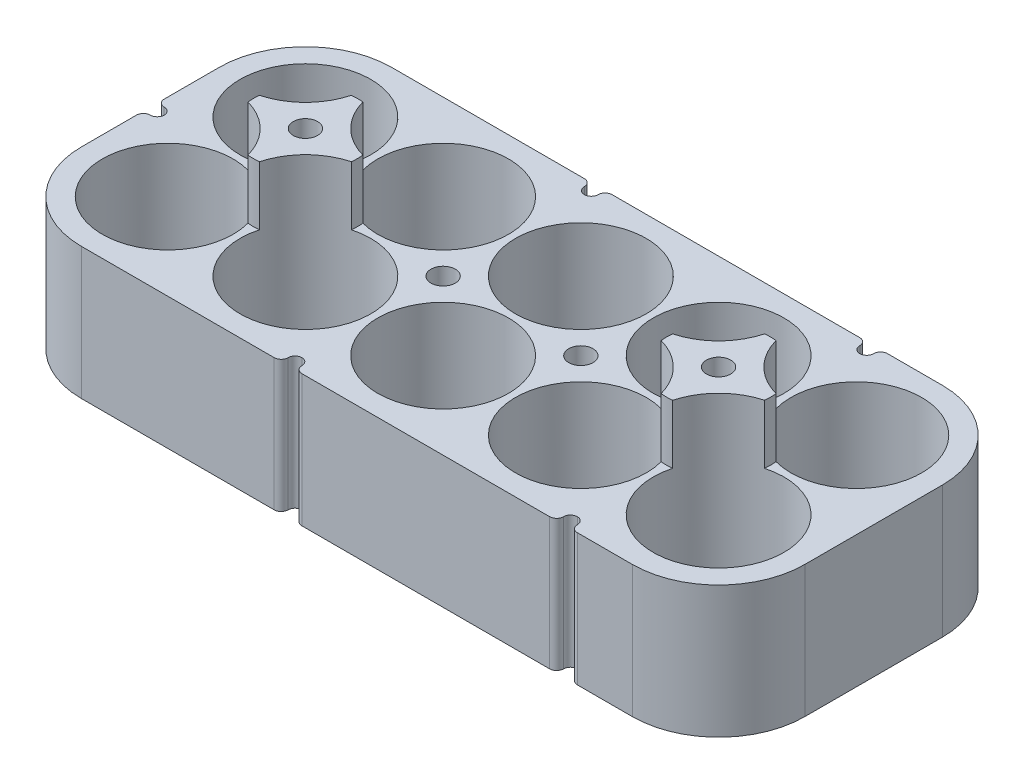
from build123d import *

# Parameters (mm, degrees)
SKETCH2_R               = 9.425
BOSS_EXTRUDE1_DEPTH     = 2.5
CUT_EXTRUDE3_DEPTH      = 57.769605644
CUT_EXTRUDE3_DEPTH_BACK = 57.769605644
SKETCH7_R               = 3
SKETCH7_R_2             = 1.75
SKETCH9_R               = 9.425
SKETCH9_R_2             = 3
BOSS_EXTRUDE2_DEPTH     = 3
SKETCH11_R              = 9.425
SKETCH11_R_2            = 3
SKETCH11_R_3            = 1.75
BOSS_EXTRUDE3_DEPTH     = 6
SKETCH12_R              = 9.425
SKETCH12_R_2            = 1.75
BOSS_EXTRUDE4_DEPTH     = 16
CUT_EXTRUDE4_DEPTH      = 3
SKETCH14_W              = 2
SKETCH14_H              = 2
CUT_EXTRUDE5_DEPTH      = 64.030057314
FILLET1_R               = 1
SKETCH15_W              = 104.25
SKETCH15_H              = 44.7
SKETCH15_R              = 7.5
CUT_EXTRUDE6_DEPTH      = 60.812524817
SKETCH16_R              = 3
BOSS_EXTRUDE5_DEPTH     = 0.3


with BuildPart() as part:
    # Sketch2 → Boss-Extrude1 (new body)
    with BuildSketch(Plane(origin=(0, 0, 0), x_dir=(1, 0, 0), z_dir=(0, 1, 0))):
        with BuildLine():
            Line((-39.7, -22.35), (39.7, -22.35))
            ThreePointArc((39.7, -22.35), (48.485801756, -18.710801756), (52.125, -9.925))
            Line((52.125, -9.925), (52.125, 9.925))
            ThreePointArc((52.125, 9.925), (48.485801756, 18.710801756), (39.7, 22.35))
            Line((39.7, 22.35), (-39.7, 22.35))
            ThreePointArc((-39.7, 22.35), (-48.485801756, 18.710801756), (-52.125, 9.925))
            Line((-52.125, 9.925), (-52.125, -9.925))
            ThreePointArc((-52.125, -9.925), (-48.485801756, -18.710801756), (-39.7, -22.35))
        make_face()
        with Locations(Location((-19.85, 9.925, 0), (0, 0, 270))):
            Circle(SKETCH2_R, mode=Mode.SUBTRACT)
        with Locations(Location((-39.7, -9.925, 0), (0, 0, 270))):
            Circle(SKETCH2_R, mode=Mode.SUBTRACT)
        with Locations(Location((-39.7, 9.925, 0), (0, 0, 270))):
            Circle(SKETCH2_R, mode=Mode.SUBTRACT)
        with Locations(Location((-19.85, -9.925, 0), (0, 0, 270))):
            Circle(SKETCH2_R, mode=Mode.SUBTRACT)
        with Locations(Location((19.85, -9.925, 0), (0, 0, 270))):
            Circle(SKETCH2_R, mode=Mode.SUBTRACT)
        with Locations(Location((39.7, 9.925, 0), (0, 0, 270))):
            Circle(SKETCH2_R, mode=Mode.SUBTRACT)
        with Locations(Location((39.7, -9.925, 0), (0, 0, 270))):
            Circle(SKETCH2_R, mode=Mode.SUBTRACT)
        with Locations(Location((19.85, 9.925, 0), (0, 0, 270))):
            Circle(SKETCH2_R, mode=Mode.SUBTRACT)
        with Locations(Location((0, -9.925, 0), (0, 0, 270))):
            Circle(SKETCH2_R, mode=Mode.SUBTRACT)
        with Locations(Location((0, 9.925, 0), (0, 0, 270))):
            Circle(SKETCH2_R, mode=Mode.SUBTRACT)
    extrude(amount=BOSS_EXTRUDE1_DEPTH)

    # Sketch7 → Cut-Extrude3 (cut, two sides: drawn at the far end of the back side and taken through both)
    with BuildSketch(Plane(origin=(0, 0, 0), x_dir=(1, 0, 0), z_dir=(0, 1, 0)).offset(-CUT_EXTRUDE3_DEPTH_BACK)):
        with Locations(Location((-29.775, 0, 0), (0, 0, 270))):
            Circle(SKETCH7_R)
        with Locations(Location((-9.925, 0, 0), (0, 0, 270))):
            Circle(SKETCH7_R_2)
        with Locations(Location((9.925, 0, 0), (0, 0, 270))):
            Circle(SKETCH7_R_2)
        with Locations(Location((29.775, 0, 0), (0, 0, 270))):
            Circle(SKETCH7_R)
    extrude(amount=CUT_EXTRUDE3_DEPTH + CUT_EXTRUDE3_DEPTH_BACK, mode=Mode.SUBTRACT)

    # Sketch9 → Boss-Extrude2 (add)
    with BuildSketch(Plane(origin=(0, 2.5, 0), x_dir=(1, 0, 0), z_dir=(0, 1, 0))):
        with BuildLine():
            Line((39.7, -22.35), (-39.7, -22.35))
            ThreePointArc((-39.7, -22.35), (-48.485801756, -18.710801756), (-52.125, -9.925))
            Line((-52.125, -9.925), (-52.125, 9.925))
            ThreePointArc((-52.125, 9.925), (-48.485801756, 18.710801756), (-39.7, 22.35))
            Line((-39.7, 22.35), (39.7, 22.35))
            ThreePointArc((39.7, 22.35), (48.485801756, 18.710801756), (52.125, 9.925))
            Line((52.125, 9.925), (52.125, -9.925))
            ThreePointArc((52.125, -9.925), (48.485801756, -18.710801756), (39.7, -22.35))
        make_face()
        with Locations(Location((39.7, -9.925, 0), (0, 0, 270))):
            Circle(SKETCH9_R, mode=Mode.SUBTRACT)
        with Locations(Location((19.85, -9.925, 0), (0, 0, 270))):
            Circle(SKETCH9_R, mode=Mode.SUBTRACT)
        with Locations(Location((0, -9.925, 0), (0, 0, 270))):
            Circle(SKETCH9_R, mode=Mode.SUBTRACT)
        with Locations(Location((-19.85, -9.925, 0), (0, 0, 270))):
            Circle(SKETCH9_R, mode=Mode.SUBTRACT)
        with Locations(Location((-39.7, -9.925, 0), (0, 0, 270))):
            Circle(SKETCH9_R, mode=Mode.SUBTRACT)
        with Locations(Location((-39.7, 9.925, 0), (0, 0, 270))):
            Circle(SKETCH9_R, mode=Mode.SUBTRACT)
        with Locations(Location((-19.85, 9.925, 0), (0, 0, 270))):
            Circle(SKETCH9_R, mode=Mode.SUBTRACT)
        with Locations(Location((0, 9.925, 0), (0, 0, 270))):
            Circle(SKETCH9_R, mode=Mode.SUBTRACT)
        with Locations(Location((19.85, 9.925, 0), (0, 0, 270))):
            Circle(SKETCH9_R, mode=Mode.SUBTRACT)
        with Locations(Location((39.7, 9.925, 0), (0, 0, 270))):
            Circle(SKETCH9_R, mode=Mode.SUBTRACT)
        with Locations(Location((29.775, 0, 0), (0, 0, 270))):
            Circle(SKETCH9_R_2, mode=Mode.SUBTRACT)
        with Locations(Location((-29.775, 0, 0), (0, 0, 270))):
            Circle(SKETCH9_R_2, mode=Mode.SUBTRACT)
        Polygon((6.460898385, 0), (8.192949192, -3), (11.657050808, -3), (13.389101615, 0), (11.657050808, 3), (8.192949192, 3), align=None, mode=Mode.SUBTRACT)
        Polygon((-6.460898385, 0), (-8.192949192, 3), (-11.657050808, 3), (-13.389101615, 0), (-11.657050808, -3), (-8.192949192, -3), align=None, mode=Mode.SUBTRACT)
    extrude(amount=BOSS_EXTRUDE2_DEPTH)

    # Sketch11 → Boss-Extrude3 (add)
    with BuildSketch(Plane(origin=(0, 5.5, 0), x_dir=(1, 0, 0), z_dir=(0, 1, 0))):
        with BuildLine():
            Line((39.7, -22.35), (-39.7, -22.35))
            ThreePointArc((-39.7, -22.35), (-48.485801756, -18.710801756), (-52.125, -9.925))
            Line((-52.125, -9.925), (-52.125, 9.925))
            ThreePointArc((-52.125, 9.925), (-48.485801756, 18.710801756), (-39.7, 22.35))
            Line((-39.7, 22.35), (39.7, 22.35))
            ThreePointArc((39.7, 22.35), (48.485801756, 18.710801756), (52.125, 9.925))
            Line((52.125, 9.925), (52.125, -9.925))
            ThreePointArc((52.125, -9.925), (48.485801756, -18.710801756), (39.7, -22.35))
        make_face()
        with Locations(Location((39.7, -9.925, 0), (0, 0, 270))):
            Circle(SKETCH11_R, mode=Mode.SUBTRACT)
        with Locations(Location((19.85, -9.925, 0), (0, 0, 270))):
            Circle(SKETCH11_R, mode=Mode.SUBTRACT)
        with Locations(Location((0, -9.925, 0), (0, 0, 270))):
            Circle(SKETCH11_R, mode=Mode.SUBTRACT)
        with Locations(Location((-19.85, -9.925, 0), (0, 0, 270))):
            Circle(SKETCH11_R, mode=Mode.SUBTRACT)
        with Locations(Location((-39.7, -9.925, 0), (0, 0, 270))):
            Circle(SKETCH11_R, mode=Mode.SUBTRACT)
        with Locations(Location((-39.7, 9.925, 0), (0, 0, 270))):
            Circle(SKETCH11_R, mode=Mode.SUBTRACT)
        with Locations(Location((-19.85, 9.925, 0), (0, 0, 270))):
            Circle(SKETCH11_R, mode=Mode.SUBTRACT)
        with Locations(Location((0, 9.925, 0), (0, 0, 270))):
            Circle(SKETCH11_R, mode=Mode.SUBTRACT)
        with Locations(Location((19.85, 9.925, 0), (0, 0, 270))):
            Circle(SKETCH11_R, mode=Mode.SUBTRACT)
        with Locations(Location((39.7, 9.925, 0), (0, 0, 270))):
            Circle(SKETCH11_R, mode=Mode.SUBTRACT)
        with Locations(Location((29.775, 0, 0), (0, 0, 270))):
            Circle(SKETCH11_R_2, mode=Mode.SUBTRACT)
        with Locations(Location((-29.775, 0, 0), (0, 0, 270))):
            Circle(SKETCH11_R_2, mode=Mode.SUBTRACT)
        with Locations(Location((-9.925, 0, 0), (0, 0, 270))):
            Circle(SKETCH11_R_3, mode=Mode.SUBTRACT)
        with Locations(Location((9.925, 0, 0), (0, 0, 270))):
            Circle(SKETCH11_R_3, mode=Mode.SUBTRACT)
    extrude(amount=BOSS_EXTRUDE3_DEPTH)

    # Sketch12 → Boss-Extrude4 (add)
    with BuildSketch(Plane(origin=(0, 11.5, 0), x_dir=(1, 0, 0), z_dir=(0, 1, 0))):
        with BuildLine():
            Line((39.7, -22.35), (-39.7, -22.35))
            ThreePointArc((-39.7, -22.35), (-48.485801756, -18.710801756), (-52.125, -9.925))
            Line((-52.125, -9.925), (-52.125, 9.925))
            ThreePointArc((-52.125, 9.925), (-48.485801756, 18.710801756), (-39.7, 22.35))
            Line((-39.7, 22.35), (39.7, 22.35))
            ThreePointArc((39.7, 22.35), (48.485801756, 18.710801756), (52.125, 9.925))
            Line((52.125, 9.925), (52.125, -9.925))
            ThreePointArc((52.125, -9.925), (48.485801756, -18.710801756), (39.7, -22.35))
        make_face()
        with Locations(Location((39.7, -9.925, 0), (0, 0, 270))):
            Circle(SKETCH12_R, mode=Mode.SUBTRACT)
        with Locations(Location((19.85, -9.925, 0), (0, 0, 270))):
            Circle(SKETCH12_R, mode=Mode.SUBTRACT)
        with Locations(Location((0, -9.925, 0), (0, 0, 270))):
            Circle(SKETCH12_R, mode=Mode.SUBTRACT)
        with Locations(Location((-19.85, -9.925, 0), (0, 0, 270))):
            Circle(SKETCH12_R, mode=Mode.SUBTRACT)
        with Locations(Location((-39.7, -9.925, 0), (0, 0, 270))):
            Circle(SKETCH12_R, mode=Mode.SUBTRACT)
        with Locations(Location((-39.7, 9.925, 0), (0, 0, 270))):
            Circle(SKETCH12_R, mode=Mode.SUBTRACT)
        with Locations(Location((-19.85, 9.925, 0), (0, 0, 270))):
            Circle(SKETCH12_R, mode=Mode.SUBTRACT)
        with Locations(Location((0, 9.925, 0), (0, 0, 270))):
            Circle(SKETCH12_R, mode=Mode.SUBTRACT)
        with Locations(Location((19.85, 9.925, 0), (0, 0, 270))):
            Circle(SKETCH12_R, mode=Mode.SUBTRACT)
        with Locations(Location((39.7, 9.925, 0), (0, 0, 270))):
            Circle(SKETCH12_R, mode=Mode.SUBTRACT)
        with Locations(Location((29.775, 0, 0), (0, 0, 270))):
            Circle(SKETCH12_R_2, mode=Mode.SUBTRACT)
        with Locations(Location((9.925, 0, 0), (0, 0, 270))):
            Circle(SKETCH12_R_2, mode=Mode.SUBTRACT)
        with Locations(Location((-9.925, 0, 0), (0, 0, 270))):
            Circle(SKETCH12_R_2, mode=Mode.SUBTRACT)
        with Locations(Location((-29.775, 0, 0), (0, 0, 270))):
            Circle(SKETCH12_R_2, mode=Mode.SUBTRACT)
    extrude(amount=BOSS_EXTRUDE4_DEPTH)

    # Sketch13 → Cut-Extrude4 (cut)
    with BuildSketch(Plane(origin=(0, 22.5, 0), x_dir=(1, 0, 0), z_dir=(0, 1, 0))):
        Polygon((-28.042949192, -3), (-26.310898385, 0), (-28.042949192, 3), (-31.507050808, 3), (-33.239101615, 0), (-31.507050808, -3), align=None)
        Polygon((28.042949192, -3), (31.507050808, -3), (33.239101615, 0), (31.507050808, 3), (28.042949192, 3), (26.310898385, 0), align=None)
    extrude(amount=-CUT_EXTRUDE4_DEPTH, mode=Mode.SUBTRACT)

    # Sketch14 → Cut-Extrude5 (cut, through all)
    with BuildSketch(Plane(origin=(0, 27.5, 0), x_dir=(1, 0, 0), z_dir=(0, 1, 0))):
        with Locations((-51.125, 0)):
            Rectangle(SKETCH14_W, SKETCH14_H)
        with Locations((29.775, -21.35)):
            Rectangle(SKETCH14_W, SKETCH14_H)
        with Locations((-9.925, -21.35)):
            Rectangle(SKETCH14_W, SKETCH14_H)
        with Locations((-9.925, 21.35)):
            Rectangle(SKETCH14_W, SKETCH14_H)
        with Locations((29.775, 21.35)):
            Rectangle(SKETCH14_W, SKETCH14_H)
    extrude(amount=-CUT_EXTRUDE5_DEPTH, mode=Mode.SUBTRACT)

    # Fillet1
    fillet1_edges = [part.edges().sort_by_distance(p)[0] for p in [
        (28.775, 13.75, -20.35),
        (30.775, 13.75, -20.35),
        (-10.925, 13.75, -20.35),
        (-8.925, 13.75, -20.35),
        (-50.125, 13.75, 1),
        (-50.125, 13.75, -1),
        (30.775, 13.75, 20.35),
        (28.775, 13.75, 20.35),
        (-8.925, 13.75, 20.35),
        (-10.925, 13.75, 20.35),
    ]]
    fillet(fillet1_edges, radius=FILLET1_R - 0.0001)  # a hair under: the kernel refuses the full size
    fillet1_2_edges = [part.edges().sort_by_distance(p)[0] for p in [
        (28.775, 27.5, -21.84995),
        (30.775, 27.5, -21.84995),
        (-10.925, 27.5, -21.84995),
        (-8.925, 27.5, -21.84995),
        (-51.62495, 27.5, 1),
        (-51.62495, 27.5, -1),
        (30.775, 27.5, 21.84995),
        (28.775, 27.5, 21.84995),
        (-8.925, 27.5, 21.84995),
        (-10.925, 27.5, 21.84995),
        (30.775, 13.75, -22.35),
        (28.775, 13.75, -22.35),
        (-8.925, 13.75, -22.35),
        (-10.925, 13.75, -22.35),
        (-52.125, 13.75, 1),
        (-52.125, 13.75, -1),
        (30.775, 13.75, 22.35),
        (28.775, 13.75, 22.35),
        (-8.925, 13.75, 22.35),
        (-10.925, 13.75, 22.35),
        (-10.632136071, 27.5, 20.642863929),
        (-9.217863929, 27.5, 20.642863929),
        (29.067863929, 27.5, 20.642863929),
        (30.482136071, 27.5, 20.642863929),
        (-50.417863929, 27.5, -0.707136071),
        (-50.417863929, 27.5, 0.707136071),
        (-9.217863929, 27.5, -20.642863929),
        (-10.632136071, 27.5, -20.642863929),
        (30.482136071, 27.5, -20.642863929),
        (29.067863929, 27.5, -20.642863929),
    ]]
    fillet(fillet1_2_edges, radius=FILLET1_R - 0.0001)  # a hair under: the kernel refuses the full size

    # Sketch15 → Cut-Extrude6 (cut, through all)
    with BuildSketch(Plane(origin=(0, 19, 0), x_dir=(1, 0, 0), z_dir=(0, 1, 0))):
        Rectangle(SKETCH15_W, SKETCH15_H)
        with Locations((-29.775, 0)):
            Circle(SKETCH15_R, mode=Mode.SUBTRACT)
        with Locations((29.775, 0)):
            Circle(SKETCH15_R, mode=Mode.SUBTRACT)
    extrude(amount=CUT_EXTRUDE6_DEPTH, mode=Mode.SUBTRACT)

    # Sketch16 → Boss-Extrude5 (add)
    with BuildSketch(Plane.XZ.offset(-11.5)):
        with Locations(Location((-29.775, 0, 0), (0, 0, 90))):
            Circle(SKETCH16_R)
        with Locations(Location((29.775, 0, 0), (0, 0, 90))):
            Circle(SKETCH16_R)
    extrude(amount=-BOSS_EXTRUDE5_DEPTH)


solid = part.part
